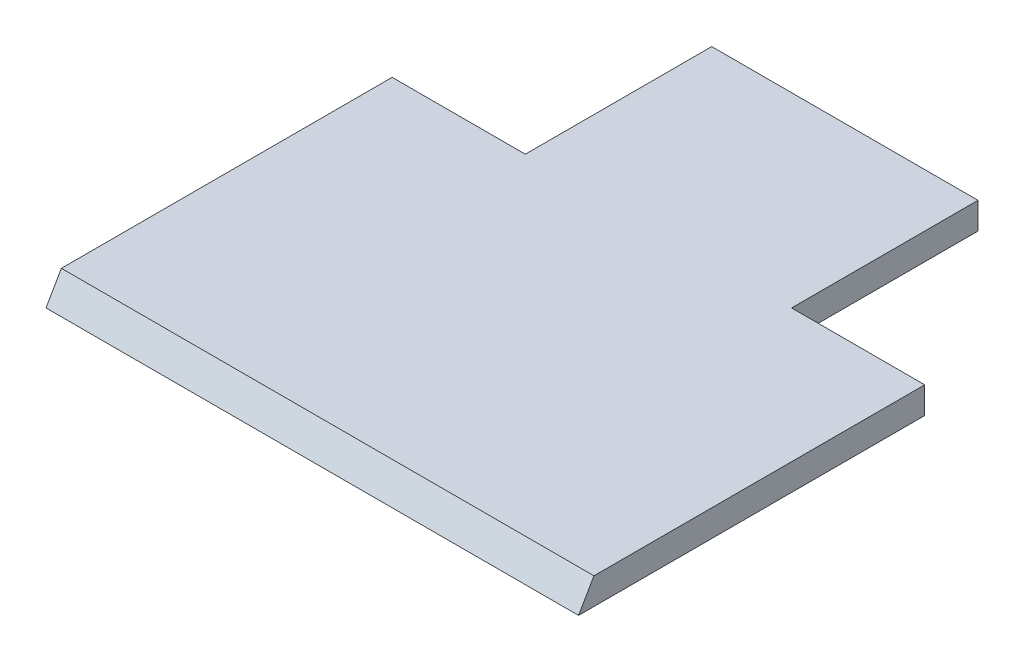
from build123d import *

# Parameters (mm, degrees)
CROQUIS1_W              = 100
CROQUIS1_H              = 100
SALIENTE_EXTRUIR1_DEPTH = 5
CHAFL_N1_SIZE2          = 2.886751346
CHAFL_N1_SIZE           = 5
CORTAR_EXTRUIR1_REACH   = 72.887
CROQUIS2_W              = 25
CROQUIS2_H              = 35


with BuildPart() as part:
    # Croquis1 → Saliente-Extruir1 (new body)
    with BuildSketch(Plane(origin=(0, 0, 0), x_dir=(1, 0, 0), z_dir=(0, 1, 0))):
        Rectangle(CROQUIS1_W, CROQUIS1_H)
    extrude(amount=SALIENTE_EXTRUIR1_DEPTH)

    # Chaflán1
    chafl_n1_edges = [part.edges().sort_by_distance(p)[0] for p in [
        (0, 5, 50),
    ]]
    chafl_n1_side = [part.faces().sort_by_distance(p)[0] for p in [
        (0, 4.942264973, 50),
    ]]
    chamfer(chafl_n1_edges, length=CHAFL_N1_SIZE - 0.0001, length2=CHAFL_N1_SIZE2 - 0.0001, reference=chafl_n1_side[0])  # a hair under: the kernel refuses the full size

    # Croquis2 → Cortar-Extruir1 (cut, up to next)
    with BuildSketch(Plane(origin=(0, 5, 0), x_dir=(1, 0, 0), z_dir=(0, 1, 0)), mode=Mode.PRIVATE) as cortar_extruir1_sk1:
        with Locations((-37.5, 32.5)):
            Rectangle(CROQUIS2_W, CROQUIS2_H)
    cortar_extruir1_tool1 = extrude(cortar_extruir1_sk1.sketch, amount=-CORTAR_EXTRUIR1_REACH, mode=Mode.PRIVATE) & part.part
    # Croquis2 → Cortar-Extruir1 (cut, up to next)
    with BuildSketch(Plane(origin=(0, 5, 0), x_dir=(1, 0, 0), z_dir=(0, 1, 0)), mode=Mode.PRIVATE) as cortar_extruir1_sk2:
        with Locations((37.5, 32.5)):
            Rectangle(CROQUIS2_W, CROQUIS2_H)
    cortar_extruir1_tool2 = extrude(cortar_extruir1_sk2.sketch, amount=-CORTAR_EXTRUIR1_REACH, mode=Mode.PRIVATE) & part.part
    add(cortar_extruir1_tool1.solids().sort_by_distance((-37.5, 5, -32.5))[0], mode=Mode.SUBTRACT)
    add(cortar_extruir1_tool2.solids().sort_by_distance((37.5, 5, -32.5))[0], mode=Mode.SUBTRACT)


solid = part.part
